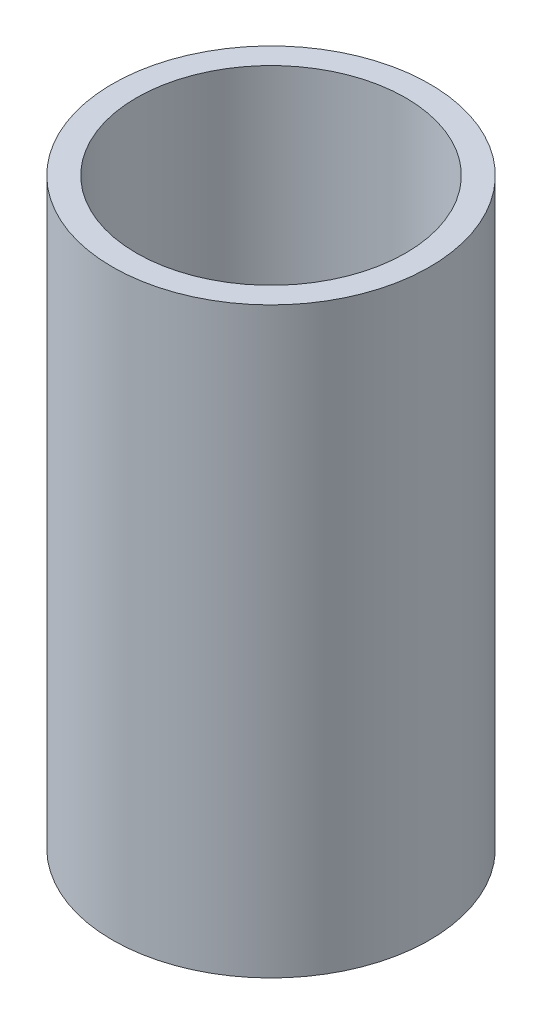
from build123d import *

# Parameters (mm, degrees)
SKETCH1_R           = 45
BOSS_EXTRUDE1_DEPTH = 165.384012739
SKETCH2_R           = 38.185553388
CUT_EXTRUDE1_DEPTH  = 178.20573261


with BuildPart() as part:
    # Sketch1 → Boss-Extrude1 (new body)
    with BuildSketch(Plane(origin=(0, 0, 0), x_dir=(1, 0, 0), z_dir=(0, 1, 0))):
        Circle(SKETCH1_R)
    extrude(amount=BOSS_EXTRUDE1_DEPTH)

    # Sketch2 → Cut-Extrude1 (cut, through all)
    with BuildSketch(Plane(origin=(0, 0, 0), x_dir=(1, 0, 0), z_dir=(0, 1, 0))):
        Circle(SKETCH2_R)
    extrude(amount=CUT_EXTRUDE1_DEPTH, mode=Mode.SUBTRACT)


solid = part.part
